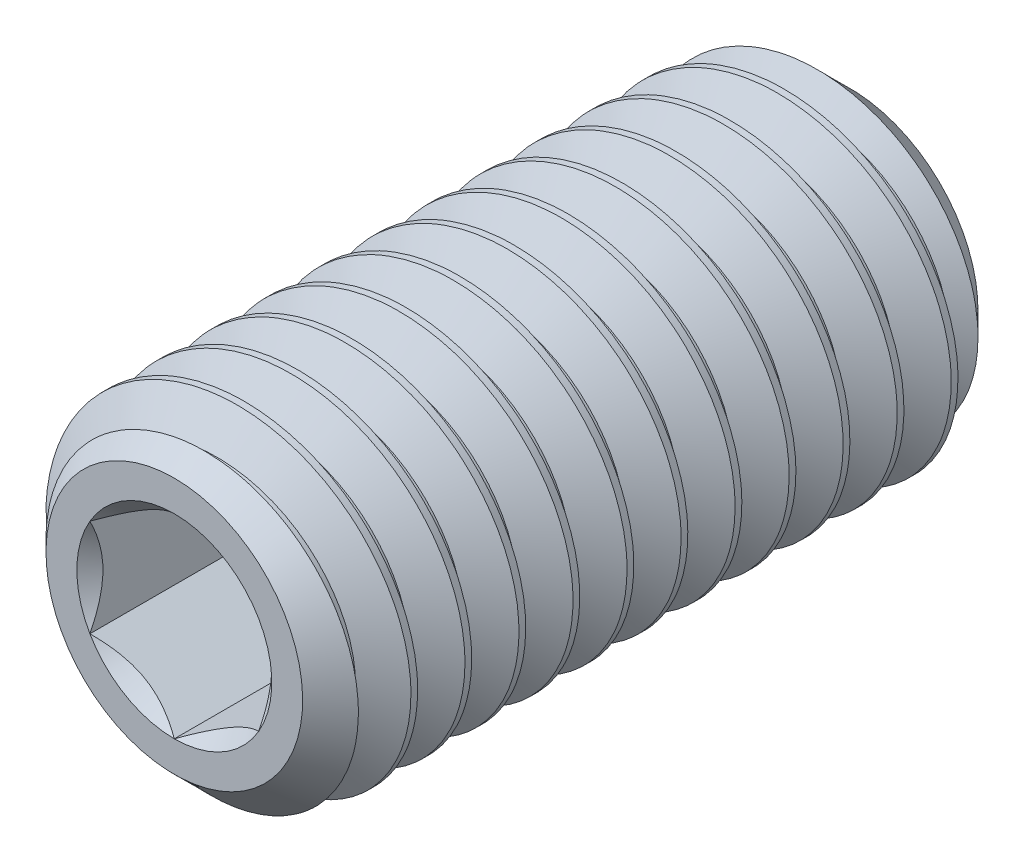
from build123d import *

# Parameters (mm, degrees)
SKETCH2_W          = 10
SKETCH2_H          = 2.5
CHAMFER1_SIZE      = 0.6
CUT_EXTRUDE1_DEPTH = 4.38
CUT_SWEEP1_PITCH   = 0.8


with BuildPart() as part:
    # Sketch2 → Revolve1 (revolve)
    with BuildSketch(Plane(origin=(0, 0, 0), x_dir=(0, 0, -1), z_dir=(1, 0, 0)), mode=Mode.PRIVATE) as revolve1_sk:
        with Locations((0, 1.25)):
            Rectangle(SKETCH2_W, SKETCH2_H)
    revolve(revolve1_sk.sketch.rotate(Axis((0, 0, 5), (0, 0, -1)), 180), axis=Axis((0, 0, 5), (0, 0, -1)))

    # Chamfer1
    chamfer1_edges = [part.edges().sort_by_distance(p)[0] for p in [
        (0, 2.5, -5),
        (0, 2.5, 5),
    ]]
    chamfer(chamfer1_edges, length=CHAMFER1_SIZE)

    # Sketch3 → Cut-Extrude1 (cut)
    with BuildSketch(Plane.XY.offset(5)):
        Polygon((0, 1.443375673), (-1.25, 0.721687836), (-1.25, -0.721687836), (0, -1.443375673), (1.25, -0.721687836), (1.25, 0.721687836), align=None)
    extrude(amount=-CUT_EXTRUDE1_DEPTH, mode=Mode.SUBTRACT)

    # Cut-Extrude2 cone 1 section (through the dimple's axis) → Cut-Extrude2 (revolve, cut)
    with BuildSketch(Plane(origin=(0, 0, 5), x_dir=(0, -1, 0), z_dir=(1, 0, 0))):
        Polygon((0, 0), (1.443375673, 0), (0, 1.443375673), align=None)
    revolve(axis=Axis((0, 0, 5), (0, 0, -1)), mode=Mode.SUBTRACT)

    # Cut-Sweep1: the profile of Sketch6 screwed along a right-hand helix of 13.5 turns, 8 arcs to a turn; built about Z, then put on its axis
    cut_sweep1_z = Axis((0, 0, 0), (0, 0, 1))
    cut_sweep1_corners = [(2.54330127, 0, -0.725), (2.54330127, 0, 0.025), (1.980384758, 0, -0.3), (1.980384758, 0, -0.4)]
    with BuildLine(mode=Mode.PRIVATE) as cut_sweep1_profile:
        Line(cut_sweep1_corners[0], cut_sweep1_corners[1])
        Line(cut_sweep1_corners[1], cut_sweep1_corners[2])
        Line(cut_sweep1_corners[2], cut_sweep1_corners[3])
        Line(cut_sweep1_corners[3], cut_sweep1_corners[0])
    cut_sweep1_cap = Face(cut_sweep1_profile.wire())
    cut_sweep1_turn_angles = [0, 22.5, 45, 67.5, 90, 112.5, 135, 157.5, 180, 202.5, 225, 247.5, 270, 292.5, 315, 337.5, 360]
    cut_sweep1_turn_weights = [1, 0.9238795325112867, 1, 0.9238795325112867, 1, 0.9238795325112867, 1, 0.9238795325112867, 1, 0.9238795325112867, 1, 0.9238795325112867, 1, 0.9238795325112867, 1, 0.9238795325112867, 1]
    cut_sweep1_turn_rails = [Edge.make_bspline([Vector(p[0], p[1], 0).rotate(cut_sweep1_z, cut_sweep1_turn_angles[k]) / cut_sweep1_turn_weights[k] + Vector(0, 0, p[2] + CUT_SWEEP1_PITCH * cut_sweep1_turn_angles[k] / 360) for k in range(17)], [0, 0, 0, 1, 1, 2, 2, 3, 3, 4, 4, 5, 5, 6, 6, 7, 7, 8, 8, 8], 2, cut_sweep1_turn_weights) for p in cut_sweep1_corners]
    cut_sweep1_turn_sides = [Face.make_surface_from_curves(cut_sweep1_turn_rails[p[0]], cut_sweep1_turn_rails[p[1]]) for p in [(0, 1), (1, 2), (2, 3), (3, 0)]]
    cut_sweep1_last_angles = [4680, 4702.5, 4725, 4747.5, 4770, 4792.5, 4815, 4837.5, 4860]
    cut_sweep1_last_weights = [1, 0.9238795325112867, 1, 0.9238795325112867, 1, 0.9238795325112867, 1, 0.923879532511226, 1]
    cut_sweep1_last_rails = [Edge.make_bspline([Vector(p[0], p[1], 0).rotate(cut_sweep1_z, cut_sweep1_last_angles[k]) / cut_sweep1_last_weights[k] + Vector(0, 0, p[2] + CUT_SWEEP1_PITCH * cut_sweep1_last_angles[k] / 360) for k in range(9)], [0, 0, 0, 1, 1, 2, 2, 3, 3, 4, 4, 4], 2, cut_sweep1_last_weights) for p in cut_sweep1_corners]
    cut_sweep1_last_sides = [Face.make_surface_from_curves(cut_sweep1_last_rails[p[0]], cut_sweep1_last_rails[p[1]]) for p in [(0, 1), (1, 2), (2, 3), (3, 0)]]
    cut_sweep1 = Plane(origin=(0, 0, 5), x_dir=(0, 1, 0), z_dir=(0, 0, -1)) * Solid(Shell([*[p.moved(Location((0, 0, CUT_SWEEP1_PITCH * i))) for i in range(13) for p in cut_sweep1_turn_sides], *cut_sweep1_last_sides, cut_sweep1_cap, cut_sweep1_cap.rotate(cut_sweep1_z, 4860).moved(Location((0, 0, CUT_SWEEP1_PITCH * 4860 / 360)))]))
    add(cut_sweep1, mode=Mode.SUBTRACT)


solid = part.part
